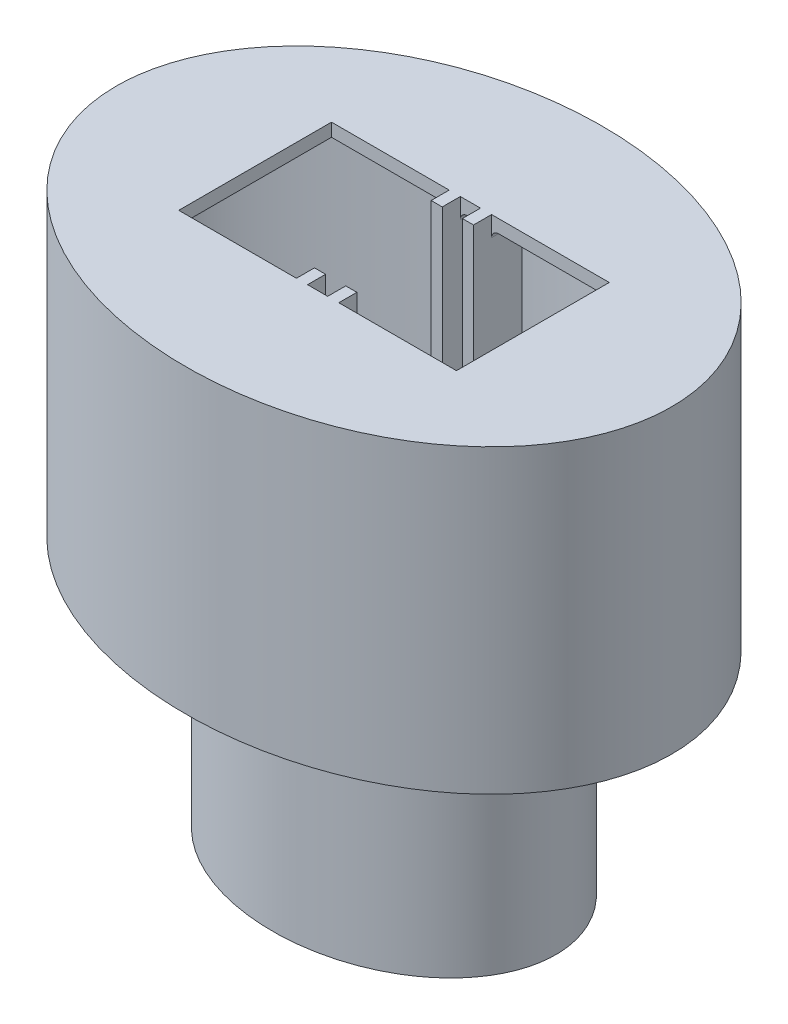
from build123d import *

# Parameters (mm, degrees)
SKETCH3_RX          = 50.8
SKETCH3_RY          = 38.1
BOSS_EXTRUDE1_DEPTH = 55.033333333
SKETCH4_RX          = 29.633333333
SKETCH4_RY          = 22.224999873
BOSS_EXTRUDE2_DEPTH = 42.333333249
CUT_EXTRUDE1_START  = -50.233333
SKETCH5_RX          = 48.4
SKETCH5_RY          = 23
CUT_EXTRUDE1_DEPTH  = 50.233333
CUT_EXTRUDE2_START  = -42.333333249
CUT_EXTRUDE2_DEPTH  = 42.333333249
CUT_EXTRUDE3_REACH  = 118.243
SKETCH7_W           = 50.8
SKETCH7_H           = 27.94
BOSS_EXTRUDE3_START = -2.4
SKETCH8_W           = 2.032
SKETCH8_H           = 8.89
BOSS_EXTRUDE3_DEPTH = 48.12
SKETCH11_W          = 2.032
SKETCH11_H          = 8.89
FILLET1_R           = 1.27


# Read off the part's stored shape, not the designer's step: Cut-Extrude2
with BuildPart() as part:
    # Sketch3 → Boss-Extrude1 (new body)
    with BuildSketch(Plane(origin=(0, 0, 0), x_dir=(1, 0, 0), z_dir=(0, 1, 0))):
        with Locations(Location((0, 0), (0, 0, 180))):
            Ellipse(SKETCH3_RX, SKETCH3_RY)
    extrude(amount=-BOSS_EXTRUDE1_DEPTH)

    # Sketch4 → Boss-Extrude2 (add)
    with BuildSketch(Plane.XZ.offset(55.033333333)):
        with Locations(Location((0, 0), (0, 0, 180))):
            Ellipse(SKETCH4_RX, SKETCH4_RY)
    extrude(amount=BOSS_EXTRUDE2_DEPTH)

    # Sketch5 → Cut-Extrude1 (cut)
    with BuildSketch(Plane(origin=(0, -2.400000026, 0), x_dir=(1, 0, 0), z_dir=(0, 1, 0)).offset(CUT_EXTRUDE1_START)):
        with Locations(Location((0, 0), (0, 0, -180))):
            Ellipse(SKETCH5_RX, SKETCH5_RY)
    extrude(amount=CUT_EXTRUDE1_DEPTH, mode=Mode.SUBTRACT)

    # Cut-Extrude2 outline → Cut-Extrude2 (cut)
    with BuildSketch(Plane(origin=(0, -94.966666556, 0), x_dir=(-1, 0, 0), z_dir=(0, -1, 0)).offset(CUT_EXTRUDE2_START)):
        with BuildLine():
            add(Edge.make_bspline(
                [(27.233333333, 0), (27.233333333, 2.494186188), (25.929720695, 7.482558564), (20.056429993, 14.138870445), (10.928145061, 18.734648365), (0, 20.370175627), (-10.928145061, 18.734648365), (-20.056429993, 14.138870445), (-25.929720695, 7.482558564), (-27.885139653, 0), (-25.929720695, -7.482558564), (-20.056429993, -14.138870445), (-10.928145061, -18.734648365), (0, -20.370175627), (10.928145061, -18.734648365), (20.056429993, -14.138870445), (25.929720695, -7.482558564), (27.233333333, -2.494186188), (27.233333333, 0)],
                knots=[0, 0, 0, 0, 0.392699082, 0.785398163, 1.178097245, 1.570796327, 1.963495408, 2.35619449, 2.748893572, 3.141592654, 3.534291735, 3.926990817, 4.319689899, 4.71238898, 5.105088062, 5.497787144, 5.890486225, 6.283185307, 6.283185307, 6.283185307, 6.283185307], degree=3))
        make_face()
    extrude(amount=CUT_EXTRUDE2_DEPTH, mode=Mode.SUBTRACT)

    # Sketch7 → Cut-Extrude3 (cut, up to next)
    with BuildSketch(Plane(origin=(0, 0, 0), x_dir=(1, 0, 0), z_dir=(0, 1, 0)), mode=Mode.PRIVATE) as cut_extrude3_sk1:
        Rectangle(SKETCH7_W, SKETCH7_H)
    cut_extrude3_tool1 = extrude(cut_extrude3_sk1.sketch, amount=-CUT_EXTRUDE3_REACH, mode=Mode.PRIVATE) & part.part
    add(cut_extrude3_tool1.solids().sort_by_distance((0, 0, 0))[0], mode=Mode.SUBTRACT)

    # Sketch8 → Boss-Extrude3 (add)
    with BuildSketch(Plane.XZ.offset(2.400000026).offset(BOSS_EXTRUDE3_START)):
        with Locations((-2.8575, 15.113)):
            Rectangle(SKETCH8_W, SKETCH8_H)
        with Locations((2.8575, 15.113)):
            Rectangle(SKETCH8_W, SKETCH8_H)
        with Locations((2.8575, -15.113)):
            Rectangle(SKETCH8_W, SKETCH8_H)
        with Locations((-2.8575, -15.113)):
            Rectangle(SKETCH8_W, SKETCH8_H)
    extrude(amount=BOSS_EXTRUDE3_DEPTH)

    # Sweep2: sweep along a path in Sketch10
    with BuildLine(Plane(origin=(0, 0, 15.113), x_dir=(-1, 0, 0), z_dir=(0, 0, -1))) as sweep2_path:
        ThreePointArc((-2.8575, -48.120000026), (0, -50.977500026), (2.8575, -48.120000026))
    # Sketch11 → Sweep2 (sweep)
    with BuildSketch(Plane.XZ.offset(48.120000026)):
        with Locations((-2.8575, 15.113)):
            Rectangle(SKETCH11_W, SKETCH11_H)
    sweep2 = sweep(path=sweep2_path.line)

    # Mirror2: Sweep2 across plane
    add(sweep2.mirror(Plane.XY))

    # Fillet1
    fillet1_edges = [part.edges().sort_by_distance(p)[0] for p in [
        (-2.8575, -2.400000026, 19.558),
        (-3.8735, -2.400000026, 16.764),
        (-1.8415, -2.400000026, 16.764),
        (2.8575, -2.400000026, 19.558),
        (1.8415, -2.400000026, 16.764),
        (3.8735, -2.400000026, 16.764),
        (1.8415, -2.400000026, -16.764),
        (2.8575, -2.400000026, -19.558),
        (3.8735, -2.400000026, -16.764),
        (-2.8575, -2.400000026, -19.558),
        (-1.8415, -2.400000026, -16.764),
        (-3.8735, -2.400000026, -16.764),
    ]]
    fillet(fillet1_edges, radius=FILLET1_R)


solid = part.part
